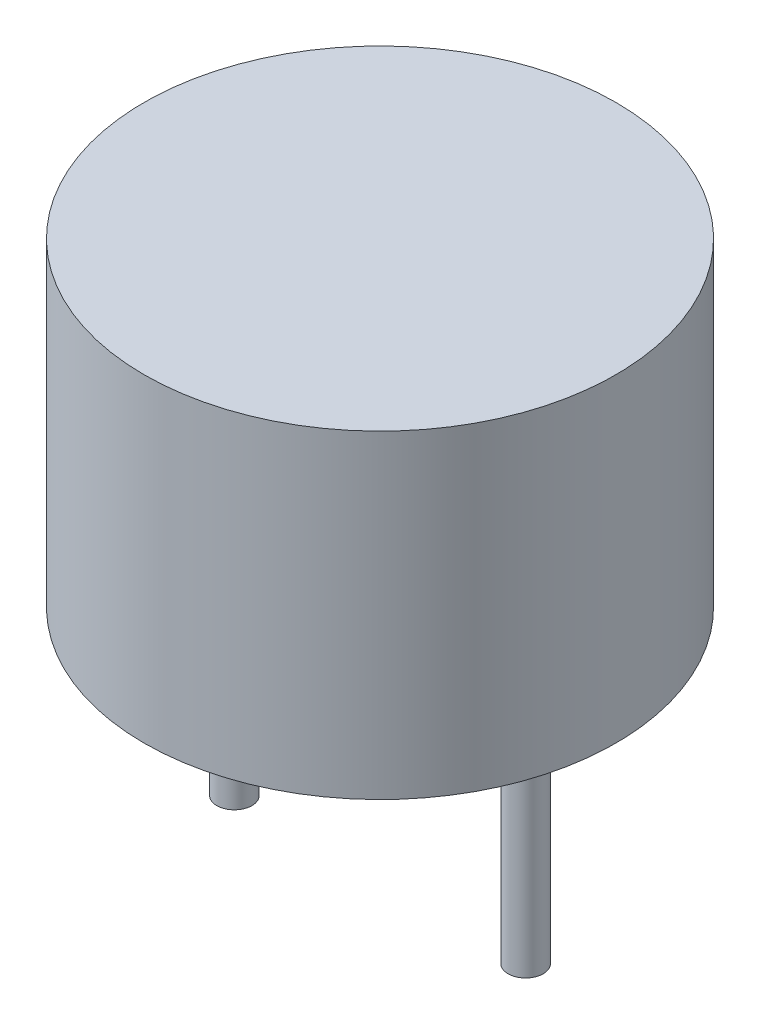
from build123d import *

# Parameters (mm, degrees)
SKETCH1_R           = 6.57225
BOSS_EXTRUDE1_DEPTH = 8.89
SKETCH2_R           = 0.48895
BOSS_EXTRUDE2_DEPTH = 6.5786


with BuildPart() as part:
    # Sketch1 → Boss-Extrude1 (new body)
    with BuildSketch(Plane(origin=(0, 0, 0), x_dir=(1, 0, 0), z_dir=(0, 1, 0))):
        Circle(SKETCH1_R)
    extrude(amount=BOSS_EXTRUDE1_DEPTH)

    # Sketch2 → Boss-Extrude2 (add)
    with BuildSketch(Plane.XZ):
        with Locations((-4.05765, 0)):
            Circle(SKETCH2_R)
        with Locations((4.05765, 0)):
            Circle(SKETCH2_R)
    extrude(amount=BOSS_EXTRUDE2_DEPTH)


solid = part.part
